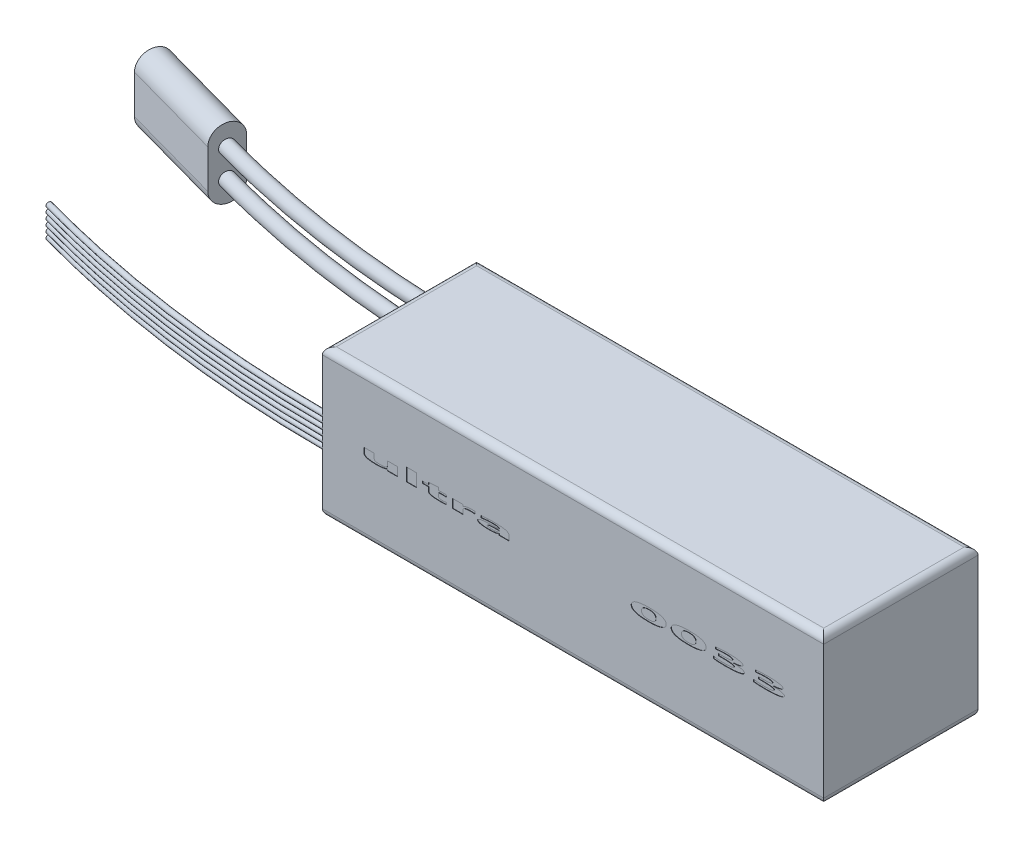
from build123d import *

# Parameters (mm, degrees)
SKETCH_1_W          = 143
SKETCH_1_H          = 42
EXTRUDE_1_DEPTH     = 22
SKETCH_2_R          = 2
SKETCH_2_R_2        = 0.75
SKETCH_32_W         = 2.902439024
SKETCH_32_H         = 3.670731708
CUT_EXTRUDE_1_DEPTH = 0.1
EXTRUDE_3_DEPTH     = 30
FILLET_1_R          = 2


with BuildPart() as part:
    # 草图1 → 凸台-拉伸1 (new, symmetric)
    with BuildSketch(Plane.XY):
        Rectangle(SKETCH_1_W, SKETCH_1_H)
    extrude(amount=EXTRUDE_1_DEPTH, both=True)

    # 扫描2: sweep along a path in 草图3
    with BuildLine(Plane(origin=(0, 0, 0), x_dir=(1, 0, 0), z_dir=(0, 1, 0))) as sweep_2_path:
        ThreePointArc((-71.5, 20), (-111.867104375, 22.728244052), (-151.5, 30.863354104))
    # 草图2 → 扫描2 (sweep)
    with BuildSketch(Plane.ZY.offset(71.5)):
        with Locations((-20, 4)):
            Circle(SKETCH_2_R)
        with Locations((21.25, 0.8)):
            Circle(SKETCH_2_R_2)
        with Locations((21.25, 2.4)):
            Circle(SKETCH_2_R_2)
        with Locations((21.25, 4)):
            Circle(SKETCH_2_R_2)
        with Locations((21.25, -0.8)):
            Circle(SKETCH_2_R_2)
        with Locations((21.25, -2.4)):
            Circle(SKETCH_2_R_2)
        with Locations((21.25, -4)):
            Circle(SKETCH_2_R_2)
        with Locations((-20, -4)):
            Circle(SKETCH_2_R)
    sweep(path=sweep_2_path.line)

    # 草图32 → 切除-拉伸1 (cut)
    # profile 1 of 9: a face of its own
    with BuildSketch(Plane.XY.offset(22)):
        with BuildLine():
            Line((-50.084332555, -0.379091749), (-52.986771579, -0.379091749))
            Line((-52.986771579, -0.379091749), (-52.986771579, 0.015725324))
            Line((-52.986771579, 0.015725324), (-53.032122189, 0.015725324))
            add(Edge.make_bspline(
                [(-53.032122189, 0.015725324), (-53.079807321, -0.00214651), (-53.177064788, -0.03859748), (-53.327216491, -0.088202246), (-53.484040644, -0.134401902), (-53.647137821, -0.176819159), (-53.816816999, -0.216165986), (-53.992663919, -0.252311657), (-54.175172874, -0.283816269), (-54.363809997, -0.313703103), (-54.559195911, -0.338308956), (-54.760968579, -0.361609314), (-54.969165309, -0.379746528), (-55.183930467, -0.395261927), (-55.404946084, -0.407057701), (-55.63260487, -0.41596219), (-55.866518719, -0.420279868), (-56.024594244, -0.421272246), (-56.104626, -0.421774676)],
                knots=[0, 0, 0, 0, 0.783356203, 1.597714767, 2.432050464, 3.29805557, 4.189850882, 5.111412776, 6.059381926, 7.038857091, 8.049295901, 9.08864698, 10.163367294, 11.263987033, 12.401079425, 13.568131017, 14.768773685, 16, 16, 16, 16], degree=3))
            add(Edge.make_bspline(
                [(-56.104626, -0.421774676), (-56.17643109, -0.421393385), (-56.317600267, -0.420643766), (-56.52592907, -0.418453944), (-56.727325476, -0.41257672), (-56.922112971, -0.406466657), (-57.10996881, -0.396984641), (-57.291125959, -0.38538358), (-57.465508282, -0.373279257), (-57.632896714, -0.357730094), (-57.793419838, -0.340382104), (-57.947094997, -0.321287509), (-58.093982454, -0.299630949), (-58.23422497, -0.277466299), (-58.367381575, -0.252028399), (-58.493897032, -0.224608336), (-58.613623479, -0.195553097), (-58.726596046, -0.16413136), (-58.832575685, -0.131045484), (-58.931534893, -0.095556321), (-59.023922189, -0.058537547), (-59.109089303, -0.018269971), (-59.188148989, 0.022847481), (-59.260241077, 0.066050678), (-59.325544247, 0.111470853), (-59.383416001, 0.159585211), (-59.435208141, 0.209004342), (-59.480505364, 0.260346462), (-59.517659763, 0.314659826), (-59.548842419, 0.370331278), (-59.573111739, 0.428248515), (-59.590452701, 0.488188485), (-59.600772295, 0.550460778), (-59.602001283, 0.592572942), (-59.602625238, 0.613953221)],
                knots=[0, 0, 0, 0, 1.76739026, 3.474698327, 5.127728865, 6.726399465, 8.27131683, 9.757059946, 11.194407816, 12.573556335, 13.894445802, 15.168327992, 16.384767607, 17.548785597, 18.662701598, 19.720904681, 20.734807802, 21.694617995, 22.606619483, 23.466789588, 24.281685953, 25.055190409, 25.78454863, 26.474263981, 27.122445841, 27.740359492, 28.324704387, 28.88319231, 29.422008092, 29.941242505, 30.451373214, 30.963962964, 31.474005631, 32, 32, 32, 32], degree=3))
            Line((-59.602625238, 0.613953221), (-59.602625238, 2.096518007))
            Line((-59.602625238, 2.096518007), (-56.700186213, 2.096518007))
            Line((-56.700186213, 2.096518007), (-56.700186213, 0.683312977))
            add(Edge.make_bspline(
                [(-56.700186213, 0.683312977), (-56.699014721, 0.660908506), (-56.696700508, 0.616649795), (-56.67460876, 0.552868669), (-56.639017287, 0.493806726), (-56.589279774, 0.439502289), (-56.525926441, 0.389938219), (-56.449202973, 0.344647672), (-56.358318064, 0.304462412), (-56.25416494, 0.267968487), (-56.136116698, 0.236411551), (-56.004796248, 0.208509387), (-55.859381699, 0.185522075), (-55.700301662, 0.166506687), (-55.527281701, 0.151075375), (-55.340431568, 0.1409434), (-55.139867429, 0.133952646), (-55.001545722, 0.133392421), (-54.930178591, 0.133103373)],
                knots=[0, 0, 0, 0, 0.53938468, 1.065522613, 1.609507161, 2.194740216, 2.832610174, 3.545037997, 4.340126746, 5.227903774, 6.207009475, 7.288086108, 8.467793818, 9.759933909, 11.155477441, 12.660710849, 14.277092672, 16, 16, 16, 16], degree=3))
            add(Edge.make_bspline(
                [(-54.930178591, 0.133103373), (-54.858369569, 0.133719622), (-54.718277665, 0.134921859), (-54.513659041, 0.141232358), (-54.319956517, 0.153264766), (-54.137617549, 0.169956792), (-53.96621711, 0.190120352), (-53.806268315, 0.216131811), (-53.657143301, 0.246665528), (-53.519940025, 0.281505073), (-53.396368451, 0.320178317), (-53.288299776, 0.362639539), (-53.196346584, 0.408185469), (-53.120567029, 0.457037315), (-53.061526521, 0.510277988), (-53.019001701, 0.567103628), (-52.991090316, 0.628019193), (-52.988201051, 0.670811389), (-52.986771579, 0.691982946)],
                knots=[0, 0, 0, 0, 1.611592577, 3.144048836, 4.593662917, 5.966345884, 7.252877499, 8.465959956, 9.601945686, 10.667996432, 11.641529703, 12.505906458, 13.271204144, 13.940929636, 14.523540873, 15.04441488, 15.527221624, 16, 16, 16, 16], degree=3))
            Line((-52.986771579, 0.691982946), (-52.986771579, 2.096518007))
            Line((-52.986771579, 2.096518007), (-50.084332555, 2.096518007))
            Line((-50.084332555, 2.096518007), (-50.084332555, -0.379091749))
        make_face()
    # profile 2 of 9: a face of its own
    with BuildSketch(Plane.XY.offset(22)):
        with Locations((-46.029454506, 1.456274105)):
            Rectangle(SKETCH_32_W, SKETCH_32_H)
    # profile 3 of 9: a face of its own
    with BuildSketch(Plane.XY.offset(22)):
        with BuildLine():
            add(Edge.make_bspline(
                [(-36.084332555, -0.330406535), (-36.112545055, -0.334354007), (-36.170883869, -0.342516729), (-36.26128665, -0.351779519), (-36.356775962, -0.362390684), (-36.457551497, -0.370646762), (-36.563583833, -0.378801757), (-36.674999377, -0.385799622), (-36.791438134, -0.39358101), (-36.913297791, -0.399277605), (-37.040234787, -0.404662009), (-37.172734776, -0.409253188), (-37.310335398, -0.413502613), (-37.453522577, -0.415707709), (-37.60179275, -0.418599011), (-37.755407311, -0.420784347), (-37.914141313, -0.421032085), (-38.021737485, -0.421524433), (-38.07642478, -0.421774676)],
                knots=[0, 0, 0, 0, 0.685165778, 1.416810188, 2.18567112, 2.996102101, 3.84874272, 4.743678953, 5.681305401, 6.65570541, 7.677937525, 8.737366787, 9.84472529, 10.989249974, 12.181892401, 13.411878814, 14.684550341, 16, 16, 16, 16], degree=3))
            add(Edge.make_bspline(
                [(-38.07642478, -0.421774676), (-38.141561847, -0.421712167), (-38.269618788, -0.421589277), (-38.458583609, -0.418673497), (-38.641323711, -0.414694375), (-38.817862291, -0.409637702), (-38.988364225, -0.402070799), (-39.152660133, -0.393486534), (-39.310759575, -0.383668794), (-39.462625257, -0.371735074), (-39.608169828, -0.357368136), (-39.747671796, -0.343203575), (-39.880850194, -0.326404339), (-40.007783997, -0.307767489), (-40.128741324, -0.287762291), (-40.243279212, -0.266542495), (-40.351845222, -0.243865467), (-40.454255107, -0.219545887), (-40.550130646, -0.192555253), (-40.640174164, -0.165384115), (-40.723980283, -0.13637085), (-40.801478247, -0.104794243), (-40.872854176, -0.072414555), (-40.938135281, -0.038182811), (-40.997274957, -0.002489651), (-41.050258472, 0.034782139), (-41.096802444, 0.073912648), (-41.137566308, 0.114216437), (-41.172025213, 0.156692799), (-41.200276418, 0.2006453), (-41.221762217, 0.246481855), (-41.237319152, 0.293694863), (-41.246921858, 0.342575568), (-41.24828255, 0.375820235), (-41.248966701, 0.392535538)],
                knots=[0, 0, 0, 0, 1.80325348, 3.545126297, 5.231839685, 6.863502107, 8.434336881, 9.956580867, 11.418095201, 12.819532181, 14.173530992, 15.466909818, 16.701264742, 17.889321508, 19.018467601, 20.095190887, 21.113927491, 22.088678474, 23.008469842, 23.870900526, 24.692278348, 25.462564036, 26.186852413, 26.861315418, 27.501995417, 28.097957442, 28.652708723, 29.183631628, 29.682480867, 30.163943228, 30.626466908, 31.079934809, 31.537394435, 32, 32, 32, 32], degree=3))
            Line((-41.248966701, 0.392535538), (-41.248966701, 1.541639959))
            Line((-41.248966701, 1.541639959), (-42.870917921, 1.541639959))
            Line((-42.870917921, 1.541639959), (-42.870917921, 2.096518007))
            Line((-42.870917921, 2.096518007), (-41.248966701, 2.096518007))
            Line((-41.248966701, 2.096518007), (-41.248966701, 2.654063739))
            Line((-41.248966701, 2.654063739), (-38.346527677, 2.86481069))
            Line((-38.346527677, 2.86481069), (-38.346527677, 2.096518007))
            Line((-38.346527677, 2.096518007), (-36.084332555, 2.096518007))
            Line((-36.084332555, 2.096518007), (-36.084332555, 1.541639959))
            Line((-36.084332555, 1.541639959), (-38.346527677, 1.541639959))
            Line((-38.346527677, 1.541639959), (-38.346527677, 0.520584318))
            add(Edge.make_bspline(
                [(-38.346527677, 0.520584318), (-38.345696005, 0.504905797), (-38.34404187, 0.473722371), (-38.328562651, 0.428735813), (-38.303025238, 0.387185436), (-38.267689273, 0.349042198), (-38.222651407, 0.314192183), (-38.168205882, 0.282179035), (-38.103694728, 0.254067474), (-38.03001121, 0.227916456), (-37.946339898, 0.205537201), (-37.852937293, 0.186619325), (-37.749703106, 0.169956036), (-37.636702683, 0.156086733), (-37.51390564, 0.145528882), (-37.381335461, 0.1385376), (-37.239031863, 0.133611309), (-37.140739622, 0.133276196), (-37.090049018, 0.133103373)],
                knots=[0, 0, 0, 0, 0.532584565, 1.059271481, 1.599389592, 2.183503827, 2.819613793, 3.532416301, 4.328769186, 5.212325726, 6.19303158, 7.275414469, 8.456548158, 9.753331147, 11.15157668, 12.652865376, 14.273838587, 16, 16, 16, 16], degree=3))
            add(Edge.make_bspline(
                [(-37.090049018, 0.133103373), (-37.008435982, 0.134145705), (-36.843501983, 0.136252182), (-36.594107398, 0.153108396), (-36.340184719, 0.179270683), (-36.170270893, 0.205302804), (-36.084332555, 0.218469227)],
                knots=[0, 0, 0, 0, 0.969215658, 1.958714213, 2.967566605, 4, 4, 4, 4], degree=3))
            Line((-36.084332555, 0.218469227), (-36.084332555, -0.330406535))
        make_face()
    # profile 4 of 9: a face of its own
    with BuildSketch(Plane.XY.offset(22)):
        with BuildLine():
            add(Edge.make_bspline(
                [(-27.974576457, 1.413591178), (-28.020338523, 1.420501335), (-28.113925991, 1.434633216), (-28.258067155, 1.451666768), (-28.409262048, 1.466415874), (-28.56759148, 1.478255144), (-28.733016881, 1.487561311), (-28.905331947, 1.494148672), (-29.084757227, 1.498229232), (-29.206821436, 1.498711231), (-29.269069598, 1.498957032)],
                knots=[0, 0, 0, 0, 0.855296309, 1.749156539, 2.682085642, 3.662721282, 4.683272414, 5.744083064, 6.84956709, 8, 8, 8, 8], degree=3))
            add(Edge.make_bspline(
                [(-29.269069598, 1.498957032), (-29.349775338, 1.498523677), (-29.507012498, 1.497679382), (-29.736529255, 1.488864161), (-29.953407106, 1.474515131), (-30.157354988, 1.453822168), (-30.348540561, 1.428200938), (-30.526824417, 1.396346957), (-30.692515786, 1.358607665), (-30.844385214, 1.315008521), (-30.981091439, 1.267115012), (-31.100231724, 1.214186327), (-31.201365924, 1.156982385), (-31.284798143, 1.095707899), (-31.350609464, 1.029447541), (-31.397010079, 0.957448693), (-31.42652061, 0.880688249), (-31.430099802, 0.827397785), (-31.43189353, 0.800691026)],
                knots=[0, 0, 0, 0, 1.597682701, 3.112728912, 4.546347598, 5.899965921, 7.170318736, 8.364240299, 9.484161559, 10.533028123, 11.490742214, 12.349614957, 13.11057891, 13.786582693, 14.393498636, 14.947753016, 15.472661606, 16, 16, 16, 16], degree=3))
            Line((-31.43189353, 0.800691026), (-31.43189353, -0.379091749))
            Line((-31.43189353, -0.379091749), (-34.334332555, -0.379091749))
            Line((-34.334332555, -0.379091749), (-34.334332555, 2.096518007))
            Line((-34.334332555, 2.096518007), (-31.43189353, 2.096518007))
            Line((-31.43189353, 2.096518007), (-31.43189353, 1.613667398))
            Line((-31.43189353, 1.613667398), (-31.395879811, 1.613667398))
            add(Edge.make_bspline(
                [(-31.395879811, 1.613667398), (-31.364347466, 1.635185413), (-31.299736272, 1.679276793), (-31.195216637, 1.739453755), (-31.080976078, 1.794279014), (-30.957884106, 1.845716881), (-30.825730764, 1.893156167), (-30.683889187, 1.935268115), (-30.533253347, 1.974985028), (-30.372916106, 2.009222516), (-30.203429916, 2.039880515), (-30.024807028, 2.066368761), (-29.836886513, 2.088983252), (-29.639878118, 2.107751714), (-29.433456614, 2.121182325), (-29.218041394, 2.132256715), (-28.993218954, 2.138039024), (-28.840242356, 2.138808453), (-28.762209841, 2.139200934)],
                knots=[0, 0, 0, 0, 0.67276467, 1.378525063, 2.123390148, 2.905023924, 3.729305773, 4.597104218, 5.51241563, 6.474729393, 7.486274052, 8.548122794, 9.657312872, 10.82243049, 12.036106449, 13.303403246, 14.624480931, 16, 16, 16, 16], degree=3))
            add(Edge.make_bspline(
                [(-28.762209841, 2.139200934), (-28.720415722, 2.139035504), (-28.639493221, 2.138715195), (-28.521891032, 2.137319989), (-28.412058879, 2.135522708), (-28.309776015, 2.132343948), (-28.215110452, 2.127229311), (-28.12791072, 2.12304412), (-28.048502662, 2.117195089), (-27.998350929, 2.111764077), (-27.974576457, 2.109189501)],
                knots=[0, 0, 0, 0, 1.272022148, 2.462911431, 3.579482566, 4.615230064, 5.57716582, 6.464773631, 7.27222462, 8, 8, 8, 8], degree=3))
            Line((-27.974576457, 2.109189501), (-27.974576457, 1.413591178))
        make_face()
    # profile 5 of 9: a face of its own
    with BuildSketch(Plane.XY.offset(22)):
        with BuildLine():
            add(Edge.make_bspline(
                [(-26.224576457, 1.928453983), (-26.165683309, 1.936156444), (-26.043328501, 1.952158869), (-25.852590781, 1.974155253), (-25.647554285, 1.99448444), (-25.428420561, 2.014909954), (-25.194899251, 2.032278932), (-24.947284293, 2.049984684), (-24.68536119, 2.065614816), (-24.413258561, 2.080792862), (-24.13915149, 2.094613203), (-23.871267476, 2.106611204), (-23.613612778, 2.116737996), (-23.366167374, 2.124515213), (-23.128975476, 2.131453155), (-22.902214526, 2.136070066), (-22.685902715, 2.138929421), (-22.545175616, 2.139111873), (-22.476481945, 2.139200934)],
                knots=[0, 0, 0, 0, 0.759015838, 1.576910728, 2.453509396, 3.392050912, 4.389328333, 5.445895971, 6.564458827, 7.742414751, 8.928581073, 10.071776556, 11.169200666, 12.223734441, 13.235502099, 14.201620747, 15.122150072, 16, 16, 16, 16], degree=3))
            add(Edge.make_bspline(
                [(-22.476481945, 2.139200934), (-22.390449246, 2.13881876), (-22.22127019, 2.138067233), (-21.97159624, 2.135889153), (-21.730184377, 2.12997237), (-21.496937941, 2.124009019), (-21.271772616, 2.114035275), (-21.054733294, 2.104020895), (-20.845996535, 2.090405674), (-20.645447807, 2.075210741), (-20.453177648, 2.057669057), (-20.268768112, 2.039474461), (-20.092933157, 2.017987294), (-19.925063958, 1.994653546), (-19.765392258, 1.969466421), (-19.613918265, 1.942322216), (-19.470854095, 1.912558466), (-19.335589526, 1.882618574), (-19.208703841, 1.848988268), (-19.08986977, 1.813816309), (-18.97924313, 1.776619305), (-18.876674155, 1.737479123), (-18.782793338, 1.695250597), (-18.696388634, 1.652143748), (-18.618206238, 1.607026992), (-18.548447303, 1.559518889), (-18.486703618, 1.510197591), (-18.433072113, 1.458694839), (-18.386928795, 1.405353976), (-18.350437764, 1.348944763), (-18.320878169, 1.291304841), (-18.301143224, 1.230936571), (-18.287631779, 1.168986285), (-18.286245956, 1.126664535), (-18.285552067, 1.1054738)],
                knots=[0, 0, 0, 0, 1.811908197, 3.563028022, 5.25827907, 6.897602554, 8.476753922, 10.004880979, 11.473295104, 12.881978147, 14.240503457, 15.539332391, 16.784393166, 17.970912619, 19.108559056, 20.188539906, 21.211418856, 22.185934266, 23.105775931, 23.97530661, 24.795529755, 25.563270918, 26.286313071, 26.962612509, 27.596189173, 28.185751791, 28.73852987, 29.258386218, 29.749960357, 30.220039771, 30.67020597, 31.109928114, 31.554336065, 32, 32, 32, 32], degree=3))
            Line((-18.285552067, 1.1054738), (-18.285552067, -0.379091749))
            Line((-18.285552067, -0.379091749), (-21.059942311, -0.379091749))
            Line((-21.059942311, -0.379091749), (-21.059942311, -0.025623761))
            Line((-21.059942311, -0.025623761), (-21.09595603, -0.025623761))
            add(Edge.make_bspline(
                [(-21.09595603, -0.025623761), (-21.139626216, -0.041983449), (-21.228596403, -0.075313386), (-21.367385622, -0.119666687), (-21.513211286, -0.161747301), (-21.666718696, -0.200328469), (-21.827817947, -0.23550364), (-21.996121483, -0.268148635), (-22.171802239, -0.297506245), (-22.354871262, -0.323261631), (-22.545380283, -0.34678221), (-22.743332052, -0.366390639), (-22.948508759, -0.383996872), (-23.161081364, -0.397879082), (-23.381212213, -0.408297105), (-23.608862463, -0.416455797), (-23.843871398, -0.421160661), (-24.003061442, -0.42156812), (-24.083760909, -0.421774676)],
                knots=[0, 0, 0, 0, 0.738801569, 1.505175939, 2.307861001, 3.143370365, 4.012548928, 4.920270715, 5.859531282, 6.834390494, 7.849306261, 8.900776063, 9.986017387, 11.112088238, 12.275838592, 13.477713152, 14.721357204, 16, 16, 16, 16], degree=3))
            add(Edge.make_bspline(
                [(-24.083760909, -0.421774676), (-24.198920355, -0.421039094), (-24.423269894, -0.41960606), (-24.751043399, -0.41125656), (-25.061235323, -0.395916225), (-25.353888607, -0.374770329), (-25.629079805, -0.347925285), (-25.886337068, -0.313720233), (-26.126299466, -0.274952653), (-26.314436997, -0.23640579), (-26.454704021, -0.201832963), (-26.551601393, -0.176163843), (-26.641549526, -0.148609509), (-26.724973621, -0.121040409), (-26.801479225, -0.091513238), (-26.871246765, -0.060836584), (-26.935237573, -0.029984605), (-26.99144622, 0.003763158), (-27.042411812, 0.036675909), (-27.085609876, 0.072192629), (-27.122658337, 0.108165422), (-27.153241468, 0.145061222), (-27.176979951, 0.1833917), (-27.193862689, 0.223172381), (-27.20433428, 0.264172947), (-27.205636081, 0.291993898), (-27.206283774, 0.305835843)],
                knots=[0, 0, 0, 0, 2.474402142, 4.820542302, 7.044383916, 9.146881687, 11.124567834, 12.984365061, 14.722173704, 16.346574191, 17.108874752, 17.826099132, 18.500025257, 19.129904934, 19.713590942, 20.261154454, 20.767430643, 21.23847857, 21.669036882, 22.069646595, 22.437818011, 22.777260327, 23.096758429, 23.402834772, 23.702888366, 24, 24, 24, 24], degree=3))
            add(Edge.make_bspline(
                [(-27.206283774, 0.305835843), (-27.20563751, 0.320121348), (-27.204339282, 0.34881833), (-27.193865343, 0.39112703), (-27.177053593, 0.432282394), (-27.153030814, 0.471923286), (-27.123188773, 0.511024874), (-27.084706863, 0.547200898), (-27.041863721, 0.58435489), (-26.990898918, 0.618888579), (-26.933837201, 0.652640693), (-26.870145219, 0.685367679), (-26.799818697, 0.716814643), (-26.722531471, 0.746297391), (-26.638758611, 0.775850791), (-26.548569972, 0.804517274), (-26.45117796, 0.830941028), (-26.34760405, 0.856917612), (-26.23710435, 0.881712283), (-26.119809043, 0.904692197), (-25.996030394, 0.927487354), (-25.865513357, 0.948833364), (-25.728321317, 0.968788221), (-25.584190838, 0.987185926), (-25.433513423, 1.005454351), (-25.276050109, 1.021788023), (-25.112025003, 1.038026954), (-24.941271561, 1.052588983), (-24.763860553, 1.065906561), (-24.57978145, 1.077913561), (-24.389013788, 1.088402745), (-24.191600469, 1.098322275), (-23.987553971, 1.108108934), (-23.849234534, 1.11255328), (-23.778978134, 1.11481069)],
                knots=[0, 0, 0, 0, 0.373265338, 0.749822201, 1.133141969, 1.532022019, 1.958867263, 2.4152634, 2.910354772, 3.441010414, 4.022378518, 4.643910476, 5.312811592, 6.036273818, 6.806806344, 7.636170386, 8.510772754, 9.445759431, 10.428986466, 11.472386951, 12.571814274, 13.720817672, 14.931250702, 16.197702588, 17.521136302, 18.901048754, 20.338220023, 21.832232123, 23.38326898, 24.991494956, 26.657057481, 28.38037376, 30.161488269, 32, 32, 32, 32], degree=3))
            Line((-23.778978134, 1.11481069), (-21.029930878, 1.204844989))
            add(Edge.make_bspline(
                [(-21.029930878, 1.204844989), (-21.031342149, 1.222207789), (-21.03416644, 1.2569549), (-21.057784194, 1.306209435), (-21.094181757, 1.351476462), (-21.145046199, 1.393052075), (-21.21006362, 1.430766996), (-21.289090245, 1.464781531), (-21.381888685, 1.496089349), (-21.488736461, 1.523588377), (-21.609853199, 1.548108339), (-21.744972082, 1.56902795), (-21.894225978, 1.587021418), (-22.057741405, 1.601184665), (-22.235585465, 1.613567919), (-22.427753239, 1.62077915), (-22.633838383, 1.626719237), (-22.775924212, 1.626908227), (-22.849290634, 1.627005812)],
                knots=[0, 0, 0, 0, 0.422546161, 0.845615815, 1.309701745, 1.834152155, 2.440668646, 3.1411821, 3.933148203, 4.831789274, 5.835398435, 6.951805147, 8.172090754, 9.508398422, 10.962157389, 12.528063162, 14.207255543, 16, 16, 16, 16], degree=3))
            add(Edge.make_bspline(
                [(-22.849290634, 1.627005812), (-22.997577517, 1.626248205), (-23.291976987, 1.6247441), (-23.730221759, 1.612357957), (-24.161802871, 1.592530273), (-24.586936231, 1.564498657), (-25.005640041, 1.528616115), (-25.417871866, 1.484512007), (-25.823757423, 1.432995401), (-26.091501727, 1.39152162), (-26.224576457, 1.370908251)],
                knots=[0, 0, 0, 0, 1.050252231, 2.085104865, 3.104918582, 4.110070253, 5.102522206, 6.081113437, 7.04627173, 8, 8, 8, 8], degree=3))
            Line((-26.224576457, 1.370908251), (-26.224576457, 1.928453983))
        make_face()
        with BuildLine():
            add(Edge.make_bspline(
                [(-22.904645055, 0.730664349), (-22.968005464, 0.728311979), (-23.090750673, 0.723754842), (-23.268670835, 0.715629194), (-23.434253348, 0.703845869), (-23.587500774, 0.691622181), (-23.728479549, 0.676940282), (-23.857284913, 0.660537625), (-23.973762321, 0.641747657), (-24.078346139, 0.622424918), (-24.170323762, 0.599474203), (-24.250575501, 0.576162708), (-24.318468477, 0.550218264), (-24.37440385, 0.522832543), (-24.417971922, 0.492730685), (-24.450177489, 0.461151868), (-24.470920631, 0.426232794), (-24.47339037, 0.401215461), (-24.474576457, 0.389200934)],
                knots=[0, 0, 0, 0, 1.825814148, 3.537065858, 5.128388005, 6.605771099, 7.963830762, 9.209661535, 10.344190327, 11.361138279, 12.270976447, 13.072992316, 13.766081826, 14.361568186, 14.862408936, 15.28340838, 15.65585823, 16, 16, 16, 16], degree=3))
            add(Edge.make_bspline(
                [(-24.474576457, 0.389200934), (-24.473347641, 0.378068266), (-24.470781886, 0.354823363), (-24.450545417, 0.322682572), (-24.419888015, 0.292716048), (-24.376983484, 0.265451022), (-24.323203851, 0.238720107), (-24.257357737, 0.214462876), (-24.17966861, 0.192193413), (-24.090855305, 0.171144847), (-23.991857571, 0.151953511), (-23.883932564, 0.135511016), (-23.767827064, 0.12152899), (-23.643469257, 0.11055637), (-23.510991763, 0.100800999), (-23.369964834, 0.09545453), (-23.220792897, 0.091063043), (-23.118508149, 0.090638316), (-23.066039872, 0.090420446)],
                knots=[0, 0, 0, 0, 0.355326299, 0.74191785, 1.18572484, 1.725754277, 2.363681972, 3.110799891, 3.972946839, 4.955541878, 6.038188062, 7.207289554, 8.457306389, 9.789433991, 11.212259461, 12.718532247, 14.316728924, 16, 16, 16, 16], degree=3))
            add(Edge.make_bspline(
                [(-23.066039872, 0.090420446), (-22.993786504, 0.091041157), (-22.852361727, 0.092256102), (-22.64507527, 0.098562189), (-22.447388428, 0.110714847), (-22.259655844, 0.127102838), (-22.081714958, 0.148441848), (-21.913722533, 0.174204066), (-21.755315905, 0.204891759), (-21.607861796, 0.239505032), (-21.474322457, 0.27836112), (-21.357215436, 0.319298073), (-21.257729693, 0.362113379), (-21.176013218, 0.407666737), (-21.112156899, 0.456199976), (-21.065638745, 0.506862016), (-21.034903995, 0.561111274), (-21.031556377, 0.599823983), (-21.029930878, 0.618621666)],
                knots=[0, 0, 0, 0, 1.576341543, 3.085444435, 4.523670979, 5.89671077, 7.196089629, 8.432817789, 9.60369801, 10.715355087, 11.735971138, 12.636397935, 13.42036075, 14.095910472, 14.673131785, 15.160879838, 15.592549461, 16, 16, 16, 16], degree=3))
            Line((-21.029930878, 0.618621666), (-21.029930878, 0.790020294))
            Line((-21.029930878, 0.790020294), (-22.904645055, 0.730664349))
        make_face(mode=Mode.SUBTRACT)
    # profile 6 of 9: a face of its own
    with BuildSketch(Plane.XY.offset(22)):
        with BuildLine():
            add(Edge.make_bspline(
                [(16.586399152, 1.31488691), (16.587460604, 1.35184137), (16.589560783, 1.424959113), (16.605226696, 1.532931622), (16.631354896, 1.637730569), (16.668160322, 1.739119924), (16.715127078, 1.837293454), (16.772956405, 1.931513792), (16.840881133, 2.022712724), (16.918921889, 2.110908321), (17.008300253, 2.194782706), (17.107328198, 2.275868166), (17.217254327, 2.352820687), (17.336610786, 2.427904718), (17.467197822, 2.498375085), (17.608154536, 2.56533737), (17.758912338, 2.630423637), (17.920517464, 2.690637787), (18.091669339, 2.747688084), (18.271927851, 2.801959173), (18.461797612, 2.851634921), (18.660690473, 2.898589561), (18.869345998, 2.939888513), (19.086651092, 2.979673438), (19.313507774, 3.014827908), (19.549708446, 3.045911307), (19.795139009, 3.074043277), (20.049737344, 3.098001081), (20.313715667, 3.117485854), (20.586660617, 3.135477283), (20.869301529, 3.147502948), (21.160974894, 3.157101897), (21.462015595, 3.162283083), (21.66566575, 3.163150746), (21.769040159, 3.163591178)],
                knots=[0, 0, 0, 0, 0.596595334, 1.180417868, 1.757658752, 2.337927806, 2.919162099, 3.512041439, 4.120157207, 4.75335437, 5.411029381, 6.097278814, 6.818387203, 7.576375327, 8.373120841, 9.212868876, 10.095728912, 11.023845381, 11.996702661, 13.008619979, 14.06306903, 15.16543593, 16.308052725, 17.497332763, 18.732598434, 20.014532479, 21.344148006, 22.721520551, 24.143567989, 25.618334816, 27.13834343, 28.711470717, 30.330716862, 32, 32, 32, 32], degree=3))
            add(Edge.make_bspline(
                [(21.769040159, 3.163591178), (21.8675231, 3.163090369), (22.061387164, 3.162104525), (22.347758011, 3.157795507), (22.624763888, 3.148871521), (22.892486458, 3.137321424), (23.150553948, 3.120802403), (23.399209968, 3.102793844), (23.638407903, 3.079800321), (23.868334029, 3.053997523), (24.089140498, 3.024709651), (24.300403849, 2.992157235), (24.502389632, 2.956271596), (24.694752835, 2.916402685), (24.877681499, 2.872857303), (25.051578113, 2.827127839), (25.21613221, 2.777508436), (25.370895689, 2.723057297), (25.516803768, 2.666883969), (25.652887533, 2.606046315), (25.779874125, 2.542169162), (25.897497224, 2.47481513), (26.00576339, 2.40434865), (26.104541647, 2.329969677), (26.193677714, 2.251956852), (26.274650792, 2.171413357), (26.344642141, 2.085994491), (26.406542217, 1.998157538), (26.458324421, 1.906061108), (26.500000007, 1.810442476), (26.53420872, 1.71188864), (26.557054054, 1.609393416), (26.571625258, 1.503601879), (26.573337784, 1.431868971), (26.574204031, 1.395584318)],
                knots=[0, 0, 0, 0, 1.699289301, 3.34505777, 4.941521012, 6.481217446, 7.968515923, 9.403287198, 10.782675334, 12.114447828, 13.395259361, 14.625642079, 15.802420234, 16.934599154, 18.014771291, 19.046595988, 20.036747331, 20.97932723, 21.876842269, 22.733664756, 23.550208438, 24.328569299, 25.071166708, 25.777721048, 26.460069466, 27.113740773, 27.745818585, 28.362985858, 28.965801526, 29.565190409, 30.160774704, 30.762808826, 31.374191657, 32, 32, 32, 32], degree=3))
            add(Edge.make_bspline(
                [(26.574204031, 1.395584318), (26.573154942, 1.359737505), (26.571079624, 1.288824918), (26.55524711, 1.184254481), (26.529802502, 1.082854502), (26.494328234, 0.984194425), (26.448178278, 0.888825869), (26.39154503, 0.796638195), (26.324546799, 0.708184462), (26.247988637, 0.622157489), (26.161028479, 0.5396574), (26.063933679, 0.459969563), (25.956050822, 0.384276092), (25.838622779, 0.310819331), (25.710937759, 0.240892783), (25.57301096, 0.174259698), (25.425075642, 0.110320118), (25.266980783, 0.04994536), (25.099574859, -0.007526388), (24.922575038, -0.060610429), (24.736587375, -0.110376024), (24.541950244, -0.157466014), (24.337736593, -0.198777928), (24.124928786, -0.238683413), (23.902602778, -0.272738413), (23.671602225, -0.304162692), (23.431498269, -0.332288591), (23.182192757, -0.35590896), (22.92387236, -0.376796129), (22.656609043, -0.393349246), (22.38023133, -0.405763398), (22.094775624, -0.415275769), (21.800182556, -0.420467312), (21.600755669, -0.421334718), (21.499604183, -0.421774676)],
                knots=[0, 0, 0, 0, 0.591203631, 1.169525965, 1.740592652, 2.313693139, 2.896013741, 3.485394424, 4.095674748, 4.724314193, 5.383208243, 6.071164273, 6.794675725, 7.555866325, 8.355240226, 9.195068535, 10.082129902, 11.013210321, 11.98629987, 13.001521767, 14.061093913, 15.162360132, 16.304575942, 17.497972414, 18.734066468, 20.014691877, 21.343964054, 22.721966588, 24.145853775, 25.619395626, 27.139358413, 28.709908231, 30.331229672, 32, 32, 32, 32], degree=3))
            add(Edge.make_bspline(
                [(21.499604183, -0.421774676), (21.3988981, -0.421274891), (21.200587996, -0.420290718), (20.907772438, -0.415966353), (20.624536887, -0.407122157), (20.351068519, -0.395255995), (20.087161994, -0.379908551), (19.832801361, -0.361372621), (19.587999221, -0.339433769), (19.352971004, -0.314160337), (19.127515977, -0.285456817), (18.911481721, -0.253943897), (18.705296153, -0.2173979), (18.508263909, -0.179397447), (18.321188107, -0.136342755), (18.143242459, -0.091471569), (17.975350491, -0.042092314), (17.81693261, 0.010544328), (17.668049959, 0.066502715), (17.52859344, 0.125577421), (17.398851676, 0.188393737), (17.27862975, 0.254133719), (17.167915922, 0.32381987), (17.066788478, 0.396644019), (16.975208403, 0.473349828), (16.89318171, 0.552801386), (16.821145867, 0.636466483), (16.758111887, 0.722928578), (16.705279601, 0.813567188), (16.661470921, 0.907168496), (16.628106359, 1.004512998), (16.604168006, 1.105000376), (16.588821868, 1.208818814), (16.58721282, 1.279263995), (16.586399152, 1.31488691)],
                knots=[0, 0, 0, 0, 1.712615856, 3.372477765, 4.979952818, 6.531461549, 8.027298714, 9.475333962, 10.868384713, 12.206861795, 13.494978618, 14.733237972, 15.919124578, 17.055730792, 18.145263708, 19.183222953, 20.176141973, 21.120592746, 22.021477112, 22.880264193, 23.695246005, 24.47187501, 25.209232672, 25.91856253, 26.589454134, 27.239099889, 27.858287275, 28.464776038, 29.056111224, 29.639648615, 30.219500471, 30.802682611, 31.394537215, 32, 32, 32, 32], degree=3))
        make_face()
        with BuildLine():
            add(Edge.make_bspline(
                [(19.531521104, 1.33289377), (19.532990161, 1.284332227), (19.535853064, 1.189695362), (19.560083196, 1.052533697), (19.601150148, 0.924943055), (19.658185174, 0.806533008), (19.731446943, 0.697431324), (19.821687162, 0.59869799), (19.927057181, 0.508518434), (20.049947268, 0.429550243), (20.187810863, 0.358578868), (20.342227483, 0.298319202), (20.512324944, 0.24744982), (20.698257461, 0.204620769), (20.900650294, 0.17267058), (21.119021284, 0.149667772), (21.353362744, 0.135565957), (21.514922974, 0.133941697), (21.598308451, 0.133103373)],
                knots=[0, 0, 0, 0, 0.867014458, 1.689640118, 2.478304703, 3.254462885, 4.029848609, 4.817072196, 5.636749971, 6.500274286, 7.420272033, 8.402520048, 9.456513617, 10.589361813, 11.808243006, 13.114215913, 14.510571044, 16, 16, 16, 16], degree=3))
            add(Edge.make_bspline(
                [(21.598308451, 0.133103373), (21.680365391, 0.133867383), (21.839284234, 0.135347034), (22.069600819, 0.150436805), (22.284094508, 0.173646633), (22.482715353, 0.207728097), (22.665913452, 0.250362167), (22.833211323, 0.30361939), (22.984726875, 0.366090441), (23.120625175, 0.437949962), (23.240490795, 0.520432668), (23.344709699, 0.612734316), (23.433059644, 0.714902487), (23.505331337, 0.826813034), (23.561169207, 0.948811177), (23.600039132, 1.080659804), (23.624866375, 1.221698955), (23.627652937, 1.319003141), (23.629082079, 1.368907489)],
                knots=[0, 0, 0, 0, 1.468813375, 2.84463594, 4.130163212, 5.329466322, 6.4501975, 7.494849724, 8.468984462, 9.380595084, 10.241678765, 11.067611189, 11.866205062, 12.65220455, 13.444676169, 14.259293387, 15.107244698, 16, 16, 16, 16], degree=3))
            add(Edge.make_bspline(
                [(23.629082079, 1.368907489), (23.62750324, 1.41900975), (23.62442683, 1.516635334), (23.601741918, 1.658322825), (23.563027493, 1.790165289), (23.50849849, 1.912196053), (23.438561837, 2.024863829), (23.352355458, 2.127192799), (23.251286788, 2.220292052), (23.133978952, 2.30225772), (23.001697644, 2.374904662), (22.854431962, 2.438478727), (22.691250734, 2.490253297), (22.513372808, 2.53454572), (22.319864139, 2.567958799), (22.110975916, 2.591452186), (21.88685996, 2.606445557), (21.732162308, 2.607941258), (21.652329031, 2.608713129)],
                knots=[0, 0, 0, 0, 0.911870718, 1.776804283, 2.604018868, 3.406531292, 4.202722726, 5.010027101, 5.83490206, 6.697256503, 7.608417478, 8.578222585, 9.612310111, 10.721455883, 11.913098478, 13.18414222, 14.546848293, 16, 16, 16, 16], degree=3))
            add(Edge.make_bspline(
                [(21.652329031, 2.608713129), (21.608756422, 2.608381758), (21.523154857, 2.607730756), (21.39681989, 2.604834665), (21.274790014, 2.597677836), (21.15666572, 2.589447243), (21.042651636, 2.577737411), (20.932648835, 2.565048191), (20.827131867, 2.547919648), (20.725731752, 2.529282948), (20.628099725, 2.50905743), (20.535058134, 2.484776592), (20.44579153, 2.45878256), (20.360667854, 2.430420565), (20.279863523, 2.398780779), (20.202907024, 2.365616856), (20.130234134, 2.329737099), (20.061910528, 2.290920273), (19.997969202, 2.249470234), (19.937587826, 2.206185445), (19.881498594, 2.160025174), (19.829279446, 2.111529988), (19.782041215, 2.05986476), (19.738320466, 2.006405856), (19.698903584, 1.950214743), (19.663497705, 1.891373108), (19.632109421, 1.830170403), (19.605379073, 1.766328507), (19.582657645, 1.700158195), (19.564090927, 1.63150978), (19.549381513, 1.560471459), (19.538594245, 1.487011018), (19.532673738, 1.410800641), (19.531909354, 1.359135689), (19.531521104, 1.33289377)],
                knots=[0, 0, 0, 0, 1.499241751, 2.945369678, 4.347187331, 5.704670573, 7.01906198, 8.290350517, 9.513894667, 10.696072694, 11.837692093, 12.943359652, 14.003483661, 15.036297512, 16.029168773, 16.988322713, 17.918744399, 18.816231915, 19.690338871, 20.539492855, 21.370962896, 22.188096171, 22.989213824, 23.777633505, 24.562781413, 25.348525201, 26.138723777, 26.927143458, 27.727786288, 28.544203282, 29.372253724, 30.222474939, 31.097150616, 32, 32, 32, 32], degree=3))
        make_face(mode=Mode.SUBTRACT)
    # profile 7 of 9: a face of its own
    with BuildSketch(Plane.XY.offset(22)):
        with BuildLine():
            add(Edge.make_bspline(
                [(27.982740616, 1.31488691), (27.983802068, 1.35184137), (27.985902246, 1.424959113), (28.001568159, 1.532931622), (28.02769636, 1.637730569), (28.064501785, 1.739119924), (28.111468541, 1.837293454), (28.169297868, 1.931513792), (28.237222597, 2.022712724), (28.315263352, 2.110908321), (28.404641717, 2.194782706), (28.503669661, 2.275868166), (28.613595791, 2.352820687), (28.73295225, 2.427904718), (28.863539286, 2.498375085), (29.004496, 2.56533737), (29.155253802, 2.630423637), (29.316858928, 2.690637787), (29.488010803, 2.747688084), (29.668269315, 2.801959173), (29.858139076, 2.851634921), (30.057031936, 2.898589561), (30.265687462, 2.939888513), (30.482992555, 2.979673438), (30.709849238, 3.014827908), (30.946049909, 3.045911307), (31.191480472, 3.074043277), (31.446078807, 3.098001081), (31.71005713, 3.117485854), (31.983002081, 3.135477283), (32.265642992, 3.147502948), (32.557316357, 3.157101897), (32.858357058, 3.162283083), (33.062007213, 3.163150746), (33.165381622, 3.163591178)],
                knots=[0, 0, 0, 0, 0.596595334, 1.180417868, 1.757658752, 2.337927806, 2.919162099, 3.512041439, 4.120157207, 4.75335437, 5.411029381, 6.097278814, 6.818387203, 7.576375327, 8.373120841, 9.212868876, 10.095728912, 11.023845381, 11.996702661, 13.008619979, 14.06306903, 15.16543593, 16.308052725, 17.497332763, 18.732598434, 20.014532479, 21.344148006, 22.721520551, 24.143567989, 25.618334816, 27.13834343, 28.711470717, 30.330716862, 32, 32, 32, 32], degree=3))
            add(Edge.make_bspline(
                [(33.165381622, 3.163591178), (33.263864564, 3.163090369), (33.457728628, 3.162104525), (33.744099474, 3.157795507), (34.021105351, 3.148871521), (34.288827921, 3.137321424), (34.546895412, 3.120802403), (34.795551431, 3.102793844), (35.034749366, 3.079800321), (35.264675493, 3.053997523), (35.485481961, 3.024709651), (35.696745313, 2.992157235), (35.898731096, 2.956271596), (36.091094299, 2.916402685), (36.274022962, 2.872857303), (36.447919576, 2.827127839), (36.612473673, 2.777508436), (36.767237153, 2.723057297), (36.913145231, 2.666883969), (37.049228996, 2.606046315), (37.176215588, 2.542169162), (37.293838687, 2.47481513), (37.402104854, 2.40434865), (37.500883111, 2.329969677), (37.590019177, 2.251956852), (37.670992255, 2.171413357), (37.740983605, 2.085994491), (37.80288368, 1.998157538), (37.854665884, 1.906061108), (37.89634147, 1.810442476), (37.930550183, 1.71188864), (37.953395517, 1.609393416), (37.967966721, 1.503601879), (37.969679247, 1.431868971), (37.970545494, 1.395584318)],
                knots=[0, 0, 0, 0, 1.699289301, 3.34505777, 4.941521012, 6.481217446, 7.968515923, 9.403287198, 10.782675334, 12.114447828, 13.395259361, 14.625642079, 15.802420234, 16.934599154, 18.014771291, 19.046595988, 20.036747331, 20.97932723, 21.876842269, 22.733664756, 23.550208438, 24.328569299, 25.071166708, 25.777721048, 26.460069466, 27.113740773, 27.745818585, 28.362985858, 28.965801526, 29.565190409, 30.160774704, 30.762808826, 31.374191657, 32, 32, 32, 32], degree=3))
            add(Edge.make_bspline(
                [(37.970545494, 1.395584318), (37.969496406, 1.359737505), (37.967421088, 1.288824918), (37.951588573, 1.184254481), (37.926143966, 1.082854502), (37.890669698, 0.984194425), (37.844519741, 0.888825869), (37.787886494, 0.796638195), (37.720888262, 0.708184462), (37.644330101, 0.622157489), (37.557369943, 0.5396574), (37.460275143, 0.459969563), (37.352392285, 0.384276092), (37.234964243, 0.310819331), (37.107279222, 0.240892783), (36.969352423, 0.174259698), (36.821417106, 0.110320118), (36.663322247, 0.04994536), (36.495916322, -0.007526388), (36.318916502, -0.060610429), (36.132928838, -0.110376024), (35.938291708, -0.157466014), (35.734078056, -0.198777928), (35.521270249, -0.238683413), (35.298944242, -0.272738413), (35.067943689, -0.304162692), (34.827839732, -0.332288591), (34.578534221, -0.35590896), (34.320213823, -0.376796129), (34.052950507, -0.393349246), (33.776572793, -0.405763398), (33.491117088, -0.415275769), (33.19652402, -0.420467312), (32.997097132, -0.421334718), (32.895945646, -0.421774676)],
                knots=[0, 0, 0, 0, 0.591203631, 1.169525965, 1.740592652, 2.313693139, 2.896013741, 3.485394424, 4.095674748, 4.724314193, 5.383208243, 6.071164273, 6.794675725, 7.555866325, 8.355240226, 9.195068535, 10.082129902, 11.013210321, 11.98629987, 13.001521767, 14.061093913, 15.162360132, 16.304575942, 17.497972414, 18.734066468, 20.014691877, 21.343964054, 22.721966588, 24.145853775, 25.619395626, 27.139358413, 28.709908231, 30.331229672, 32, 32, 32, 32], degree=3))
            add(Edge.make_bspline(
                [(32.895945646, -0.421774676), (32.795239563, -0.421274891), (32.59692946, -0.420290718), (32.304113902, -0.415966353), (32.02087835, -0.407122157), (31.747409983, -0.395255995), (31.483503458, -0.379908551), (31.229142824, -0.361372621), (30.984340685, -0.339433769), (30.749312467, -0.314160337), (30.52385744, -0.285456817), (30.307823184, -0.253943897), (30.101637616, -0.2173979), (29.904605373, -0.179397447), (29.71752957, -0.136342755), (29.539583923, -0.091471569), (29.371691954, -0.042092314), (29.213274074, 0.010544328), (29.064391422, 0.066502715), (28.924934904, 0.125577421), (28.795193139, 0.188393737), (28.674971214, 0.254133719), (28.564257385, 0.32381987), (28.463129942, 0.396644019), (28.371549867, 0.473349828), (28.289523174, 0.552801386), (28.217487331, 0.636466483), (28.15445335, 0.722928578), (28.101621065, 0.813567188), (28.057812384, 0.907168496), (28.024447823, 1.004512998), (28.00050947, 1.105000376), (27.985163332, 1.208818814), (27.983554284, 1.279263995), (27.982740616, 1.31488691)],
                knots=[0, 0, 0, 0, 1.712615856, 3.372477765, 4.979952818, 6.531461549, 8.027298714, 9.475333962, 10.868384713, 12.206861795, 13.494978618, 14.733237972, 15.919124578, 17.055730792, 18.145263708, 19.183222953, 20.176141973, 21.120592746, 22.021477112, 22.880264193, 23.695246005, 24.47187501, 25.209232672, 25.91856253, 26.589454134, 27.239099889, 27.858287275, 28.464776038, 29.056111224, 29.639648615, 30.219500471, 30.802682611, 31.394537215, 32, 32, 32, 32], degree=3))
        make_face()
        with BuildLine():
            add(Edge.make_bspline(
                [(30.927862567, 1.33289377), (30.929331624, 1.284332227), (30.932194527, 1.189695362), (30.956424659, 1.052533697), (30.997491611, 0.924943055), (31.054526637, 0.806533008), (31.127788407, 0.697431324), (31.218028626, 0.59869799), (31.323398645, 0.508518434), (31.446288731, 0.429550243), (31.584152326, 0.358578868), (31.738568946, 0.298319202), (31.908666408, 0.24744982), (32.094598924, 0.204620769), (32.296991758, 0.17267058), (32.515362747, 0.149667772), (32.749704207, 0.135565957), (32.911264437, 0.133941697), (32.994649915, 0.133103373)],
                knots=[0, 0, 0, 0, 0.867014458, 1.689640118, 2.478304703, 3.254462885, 4.029848609, 4.817072196, 5.636749971, 6.500274286, 7.420272033, 8.402520048, 9.456513617, 10.589361813, 11.808243006, 13.114215913, 14.510571044, 16, 16, 16, 16], degree=3))
            add(Edge.make_bspline(
                [(32.994649915, 0.133103373), (33.076706855, 0.133867383), (33.235625697, 0.135347034), (33.465942283, 0.150436805), (33.680435971, 0.173646633), (33.879056817, 0.207728097), (34.062254915, 0.250362167), (34.229552787, 0.30361939), (34.381068339, 0.366090441), (34.516966638, 0.437949962), (34.636832258, 0.520432668), (34.741051163, 0.612734316), (34.829401108, 0.714902487), (34.9016728, 0.826813034), (34.957510671, 0.948811177), (34.996380595, 1.080659804), (35.021207838, 1.221698955), (35.0239944, 1.319003141), (35.025423543, 1.368907489)],
                knots=[0, 0, 0, 0, 1.468813375, 2.84463594, 4.130163212, 5.329466322, 6.4501975, 7.494849724, 8.468984462, 9.380595084, 10.241678765, 11.067611189, 11.866205062, 12.65220455, 13.444676169, 14.259293387, 15.107244698, 16, 16, 16, 16], degree=3))
            add(Edge.make_bspline(
                [(35.025423543, 1.368907489), (35.023844704, 1.41900975), (35.020768294, 1.516635334), (34.998083382, 1.658322825), (34.959368956, 1.790165289), (34.904839954, 1.912196053), (34.8349033, 2.024863829), (34.748696922, 2.127192799), (34.647628251, 2.220292052), (34.530320415, 2.30225772), (34.398039108, 2.374904662), (34.250773425, 2.438478727), (34.087592197, 2.490253297), (33.909714271, 2.53454572), (33.716205602, 2.567958799), (33.507317379, 2.591452186), (33.283201423, 2.606445557), (33.128503772, 2.607941258), (33.048670494, 2.608713129)],
                knots=[0, 0, 0, 0, 0.911870718, 1.776804283, 2.604018868, 3.406531292, 4.202722726, 5.010027101, 5.83490206, 6.697256503, 7.608417478, 8.578222585, 9.612310111, 10.721455883, 11.913098478, 13.18414222, 14.546848293, 16, 16, 16, 16], degree=3))
            add(Edge.make_bspline(
                [(33.048670494, 2.608713129), (33.005097885, 2.608381758), (32.91949632, 2.607730756), (32.793161354, 2.604834665), (32.671131478, 2.597677836), (32.553007184, 2.589447243), (32.438993099, 2.577737411), (32.328990299, 2.565048191), (32.22347333, 2.547919648), (32.122073216, 2.529282948), (32.024441189, 2.50905743), (31.931399597, 2.484776592), (31.842132993, 2.45878256), (31.757009317, 2.430420565), (31.676204987, 2.398780779), (31.599248487, 2.365616856), (31.526575597, 2.329737099), (31.458251991, 2.290920273), (31.394310666, 2.249470234), (31.33392929, 2.206185445), (31.277840057, 2.160025174), (31.225620909, 2.111529988), (31.178382679, 2.05986476), (31.13466193, 2.006405856), (31.095245048, 1.950214743), (31.059839169, 1.891373108), (31.028450885, 1.830170403), (31.001720537, 1.766328507), (30.978999109, 1.700158195), (30.96043239, 1.63150978), (30.945722977, 1.560471459), (30.934935709, 1.487011018), (30.929015201, 1.410800641), (30.928250817, 1.359135689), (30.927862567, 1.33289377)],
                knots=[0, 0, 0, 0, 1.499241751, 2.945369678, 4.347187331, 5.704670573, 7.01906198, 8.290350517, 9.513894667, 10.696072694, 11.837692093, 12.943359652, 14.003483661, 15.036297512, 16.029168773, 16.988322713, 17.918744399, 18.816231915, 19.690338871, 20.539492855, 21.370962896, 22.188096171, 22.989213824, 23.777633505, 24.562781413, 25.348525201, 26.138723777, 26.927143458, 27.727786288, 28.544203282, 29.372253724, 30.222474939, 31.097150616, 32, 32, 32, 32], degree=3))
        make_face(mode=Mode.SUBTRACT)
    # profile 8 of 9: a face of its own
    with BuildSketch(Plane.XY.offset(22)):
        with BuildLine():
            add(Edge.make_bspline(
                [(40.104691835, 0.389200934), (40.223736752, 0.36849134), (40.466407032, 0.326275317), (40.839060012, 0.275178001), (41.226190412, 0.231061566), (41.627808534, 0.19527144), (42.044291358, 0.167333518), (42.475441083, 0.147620766), (42.921247995, 0.135306603), (43.223205055, 0.133845594), (43.376604945, 0.133103373)],
                knots=[0, 0, 0, 0, 0.882408417, 1.798768929, 2.746508671, 3.727813784, 4.743205118, 5.79477461, 6.879703843, 8, 8, 8, 8], degree=3))
            add(Edge.make_bspline(
                [(43.376604945, 0.133103373), (43.472644226, 0.133485239), (43.659851656, 0.134229602), (43.932898766, 0.140055516), (44.190815345, 0.1507206), (44.433373889, 0.165477213), (44.660922757, 0.182975436), (44.873152367, 0.205314171), (45.069830797, 0.233157949), (45.224057519, 0.257918524), (45.338526642, 0.282196259), (45.417706102, 0.298883239), (45.491330784, 0.317633665), (45.559300044, 0.337737811), (45.621923985, 0.358101611), (45.678975236, 0.37978097), (45.730995666, 0.401183895), (45.777149287, 0.424765148), (45.817965925, 0.448709984), (45.85386433, 0.473198398), (45.883522413, 0.499400663), (45.909457328, 0.525211049), (45.927542241, 0.553718958), (45.942537576, 0.581863468), (45.950633718, 0.611733542), (45.951714818, 0.631918947), (45.952252811, 0.641963892)],
                knots=[0, 0, 0, 0, 2.536367909, 4.94409077, 7.212273873, 9.353246897, 11.36155121, 13.239195802, 14.987812129, 16.607421793, 17.36276316, 18.077903175, 18.744316066, 19.368530929, 19.949649274, 20.482884317, 20.980127052, 21.434368111, 21.850221343, 22.229713014, 22.579325872, 22.894947644, 23.191306386, 23.46699722, 23.734759686, 24, 24, 24, 24], degree=3))
            add(Edge.make_bspline(
                [(45.952252811, 0.641963892), (45.951538892, 0.652250759), (45.950097839, 0.673014919), (45.94038248, 0.703884893), (45.923225068, 0.733177447), (45.899955451, 0.761374887), (45.871022115, 0.789231686), (45.83450901, 0.814654969), (45.792372601, 0.839987373), (45.744000269, 0.864958607), (45.688759378, 0.887870796), (45.626885132, 0.909648738), (45.559222776, 0.931788567), (45.484901179, 0.952470918), (45.403953663, 0.971330651), (45.316748071, 0.991059686), (45.222844374, 1.008812697), (45.12272488, 1.025322231), (45.016883265, 1.041238442), (44.905757608, 1.05664276), (44.789259054, 1.070730315), (44.66758621, 1.083028406), (44.540692148, 1.095364142), (44.408585981, 1.105677723), (44.271452031, 1.115954407), (44.1289145, 1.124329611), (43.981322719, 1.132583026), (43.828346456, 1.138949441), (43.670521698, 1.145163399), (43.507339305, 1.149822394), (43.339040256, 1.152888796), (43.165422465, 1.155830769), (42.986679869, 1.156926065), (42.865743657, 1.157302589), (42.804386957, 1.157493617)],
                knots=[0, 0, 0, 0, 0.300274564, 0.606107667, 0.93451663, 1.285189072, 1.670754038, 2.103023869, 2.580475328, 3.105803022, 3.690361163, 4.324639825, 5.020347693, 5.768244966, 6.575710035, 7.446414137, 8.378056456, 9.364906314, 10.408422715, 11.502396631, 12.639760979, 13.83372035, 15.07224322, 16.361349584, 17.701722759, 19.086555071, 20.529323834, 22.016832071, 23.555948504, 25.140034242, 26.782194463, 28.469660146, 30.20889047, 32, 32, 32, 32], degree=3))
            Line((42.804386957, 1.157493617), (41.555911348, 1.157493617))
            Line((41.555911348, 1.157493617), (41.555911348, 1.712371666))
            Line((41.555911348, 1.712371666), (42.704348848, 1.712371666))
            add(Edge.make_bspline(
                [(42.704348848, 1.712371666), (42.762148978, 1.712539156), (42.875972123, 1.712868986), (43.044036434, 1.714297683), (43.206553364, 1.716019821), (43.363720254, 1.719575901), (43.515334316, 1.723560443), (43.66141329, 1.727945157), (43.801892871, 1.734274681), (43.93686994, 1.740560594), (44.066452787, 1.748832205), (44.190292896, 1.757347709), (44.308773649, 1.766838606), (44.421772812, 1.776446944), (44.52932208, 1.788118142), (44.631228332, 1.799708308), (44.72765427, 1.813360527), (44.818607447, 1.827214014), (44.904091865, 1.841588305), (44.98381821, 1.857920022), (45.058137912, 1.874354485), (45.127198918, 1.891523632), (45.190503037, 1.910323885), (45.248425976, 1.929427843), (45.301043734, 1.949486685), (45.348011156, 1.970654239), (45.389858114, 1.992321812), (45.425346378, 2.016175982), (45.456283372, 2.039624928), (45.481172381, 2.064662277), (45.501391394, 2.089989445), (45.51441675, 2.117280415), (45.524154751, 2.144990282), (45.525000043, 2.164237683), (45.525423543, 2.173880812)],
                knots=[0, 0, 0, 0, 1.878819978, 3.699873991, 5.463194502, 7.16173048, 8.809869279, 10.393210295, 11.912100496, 13.380793243, 14.785350947, 16.132698773, 17.415726841, 18.648949728, 19.818831892, 20.932061963, 21.982619903, 22.984169111, 23.922682354, 24.799911699, 25.629160798, 26.396803969, 27.112487423, 27.775171609, 28.379065623, 28.941826648, 29.44935951, 29.908321327, 30.330419158, 30.708535398, 31.053958764, 31.377123234, 31.68793287, 32, 32, 32, 32], degree=3))
            add(Edge.make_bspline(
                [(45.525423543, 2.173880812), (45.523687999, 2.191758476), (45.520149191, 2.228211395), (45.491944499, 2.279342071), (45.448452693, 2.326176144), (45.38707772, 2.367524302), (45.310631514, 2.406871764), (45.216710616, 2.441375452), (45.106754942, 2.474006111), (44.97939076, 2.502073384), (44.835388217, 2.527127115), (44.674522173, 2.548863462), (44.497028362, 2.567316737), (44.302663436, 2.582508636), (44.091415969, 2.594260999), (43.863077801, 2.603041955), (43.617823745, 2.607266215), (43.448633537, 2.6082204), (43.361265768, 2.608713129)],
                knots=[0, 0, 0, 0, 0.371029468, 0.756536616, 1.189535235, 1.694859689, 2.289724747, 2.979122869, 3.776779349, 4.679554417, 5.695924626, 6.823200399, 8.062721306, 9.415493511, 10.88691691, 12.472974753, 14.17868698, 16, 16, 16, 16], degree=3))
            add(Edge.make_bspline(
                [(43.361265768, 2.608713129), (43.243880613, 2.608076655), (43.009957087, 2.606808299), (42.660425185, 2.596452582), (42.313557903, 2.579908245), (41.969140866, 2.556503128), (41.62737173, 2.526632043), (41.288087858, 2.489750782), (40.951372238, 2.446866742), (40.72819285, 2.412458741), (40.616886957, 2.395298495)],
                knots=[0, 0, 0, 0, 1.022382382, 2.037389569, 3.045399102, 4.046796438, 5.04390354, 6.033263318, 7.019132624, 8, 8, 8, 8], degree=3))
            Line((40.616886957, 2.395298495), (40.616886957, 2.981521818))
            add(Edge.make_bspline(
                [(40.616886957, 2.981521818), (40.739764352, 2.996284888), (40.990579173, 3.026418964), (41.37557245, 3.062296892), (41.776434086, 3.0936729), (42.193301307, 3.119677864), (42.626191666, 3.139604007), (43.075310034, 3.153206669), (43.540407308, 3.162312401), (43.855894161, 3.16316036), (44.016181927, 3.163591178)],
                knots=[0, 0, 0, 0, 0.871957003, 1.779820776, 2.724053864, 3.704908554, 4.722536368, 5.77718348, 6.87066516, 8, 8, 8, 8], degree=3))
            add(Edge.make_bspline(
                [(44.016181927, 3.163591178), (44.097769143, 3.163508294), (44.259169766, 3.163344327), (44.498383533, 3.160675139), (44.731801846, 3.155780207), (44.959246815, 3.150142336), (45.180869209, 3.141716947), (45.396575421, 3.133127423), (45.606575505, 3.120186014), (45.810766293, 3.108473961), (46.009012382, 3.092616452), (46.201305544, 3.075905778), (46.38795163, 3.058537315), (46.568532719, 3.037042625), (46.743477681, 3.016598247), (46.912304785, 2.991949321), (47.075598786, 2.96705924), (47.23231581, 2.939710413), (47.38131895, 2.91121488), (47.521551932, 2.881566756), (47.651924593, 2.84931047), (47.772863153, 2.817040159), (47.883821069, 2.78288723), (47.985542651, 2.747973829), (48.077217813, 2.710454743), (48.159944384, 2.673063124), (48.231952615, 2.632639195), (48.29548575, 2.592344741), (48.348823631, 2.54974655), (48.393193948, 2.506114528), (48.42784845, 2.460694587), (48.452000864, 2.413427868), (48.46810137, 2.364989744), (48.469730786, 2.331841919), (48.470545494, 2.315268007)],
                knots=[0, 0, 0, 0, 1.668785427, 3.301289324, 4.89308642, 6.444181465, 7.954798606, 9.429428007, 10.859555896, 12.258181077, 13.612707996, 14.927192361, 16.206281056, 17.446576439, 18.646765029, 19.808764791, 20.936120311, 22.025305534, 23.062449074, 24.039013751, 24.956578471, 25.809226136, 26.598862045, 27.330829328, 28.008024094, 28.624451509, 29.18623245, 29.695769501, 30.161618035, 30.579603496, 30.966105498, 31.324027608, 31.662013804, 32, 32, 32, 32], degree=3))
            add(Edge.make_bspline(
                [(48.470545494, 2.315268007), (48.470039959, 2.301443583), (48.469028562, 2.273785784), (48.460550956, 2.232805081), (48.447475485, 2.19244357), (48.427557388, 2.153880851), (48.40343177, 2.115776028), (48.372948669, 2.079540178), (48.338338349, 2.042993694), (48.297335921, 2.008579242), (48.251006693, 1.975233264), (48.199495523, 1.942629473), (48.142868075, 1.910531484), (48.080518239, 1.880115011), (48.013268911, 1.849922755), (47.940296166, 1.821576555), (47.862198664, 1.793214713), (47.778316221, 1.767093694), (47.689228611, 1.740826274), (47.594757324, 1.715539017), (47.494877482, 1.691667692), (47.389655811, 1.668995342), (47.279126841, 1.647142367), (47.163143263, 1.625591586), (47.041655815, 1.605928206), (46.914792436, 1.586233817), (46.782411764, 1.5687057), (46.644868443, 1.551002993), (46.501853497, 1.535317116), (46.353393923, 1.519718082), (46.19949447, 1.506095667), (46.040364744, 1.492406168), (45.875812865, 1.480675335), (45.764184519, 1.473338571), (45.707492902, 1.46961252)],
                knots=[0, 0, 0, 0, 0.436704151, 0.873691049, 1.31824417, 1.774046633, 2.241990266, 2.74149471, 3.268435509, 3.831852881, 4.430804696, 5.072333511, 5.758480767, 6.487771483, 7.264976979, 8.08860087, 8.962376785, 9.891588519, 10.865809212, 11.899048599, 12.983339086, 14.112473383, 15.302120292, 16.545677692, 17.842218983, 19.193196094, 20.604783511, 22.06424538, 23.577881842, 25.153664325, 26.784059485, 28.462858297, 30.203625803, 32, 32, 32, 32], degree=3))
            Line((45.707492902, 1.46961252), (45.707492902, 1.458274867))
            add(Edge.make_bspline(
                [(45.707492902, 1.458274867), (45.825555784, 1.454261129), (46.055549783, 1.446442112), (46.391323984, 1.427823478), (46.708874892, 1.403341167), (47.008240983, 1.372995325), (47.289312193, 1.336257884), (47.552314231, 1.294672742), (47.797117981, 1.247054696), (47.98881818, 1.201272647), (48.131657704, 1.162520554), (48.230280282, 1.133259763), (48.321725978, 1.102481908), (48.406987419, 1.072145844), (48.484965323, 1.040019979), (48.556429262, 1.007424244), (48.621208253, 0.97442416), (48.67886401, 0.93997829), (48.730596423, 0.905954213), (48.774475225, 0.86959169), (48.812581971, 0.833603433), (48.843575884, 0.796360983), (48.867054228, 0.757710955), (48.885138846, 0.718824901), (48.895313891, 0.678493152), (48.896693981, 0.651351166), (48.897374762, 0.637962367)],
                knots=[0, 0, 0, 0, 2.480163976, 4.831517118, 7.059916733, 9.166563279, 11.148249778, 13.010578713, 14.756179723, 16.382979133, 17.147256051, 17.863444623, 18.542391619, 19.172840638, 19.763100169, 20.312391729, 20.821740998, 21.288414224, 21.722083755, 22.120103828, 22.483204873, 22.821456893, 23.133651955, 23.430318601, 23.718983355, 24, 24, 24, 24], degree=3))
            add(Edge.make_bspline(
                [(48.897374762, 0.637962367), (48.8960918, 0.617411998), (48.893512433, 0.576095941), (48.876336935, 0.515016634), (48.84656839, 0.456563577), (48.806890215, 0.399112444), (48.754658947, 0.344487833), (48.691308993, 0.29201285), (48.617334494, 0.240352303), (48.531798616, 0.190667182), (48.434785515, 0.142793487), (48.326659709, 0.097081097), (48.207298711, 0.053053467), (48.076613247, 0.010681609), (47.93455472, -0.030697024), (47.781045368, -0.069894538), (47.616151749, -0.106964787), (47.440729598, -0.142821602), (47.255982312, -0.176794879), (47.062849364, -0.207699496), (46.862421887, -0.238029931), (46.654080798, -0.265372478), (46.438307764, -0.289450965), (46.215201338, -0.313369559), (45.984369153, -0.333675172), (45.74604057, -0.352276674), (45.499961467, -0.369215227), (45.246483319, -0.38286912), (44.985266058, -0.394904229), (44.716719183, -0.405065967), (44.440588539, -0.412139112), (44.156918622, -0.417493336), (43.865688183, -0.420883351), (43.668939421, -0.421475121), (43.569345037, -0.421774676)],
                knots=[0, 0, 0, 0, 0.349960395, 0.70358753, 1.070990115, 1.462710781, 1.88856369, 2.353421714, 2.861755159, 3.423401611, 4.03629945, 4.702920053, 5.421632648, 6.202214829, 7.042066875, 7.941003866, 8.899839729, 9.919996846, 10.990025689, 12.0985093, 13.250713143, 14.442051954, 15.676638109, 16.948034092, 18.263183571, 19.622655266, 21.019057521, 22.463653943, 23.945487188, 25.472239325, 27.040132431, 28.649401713, 30.303924401, 32, 32, 32, 32], degree=3))
            add(Edge.make_bspline(
                [(43.569345037, -0.421774676), (43.480866391, -0.421654946), (43.305907573, -0.421418191), (43.046917795, -0.419286448), (42.79436233, -0.416289862), (42.548503955, -0.410515889), (42.309067478, -0.404738164), (42.07606334, -0.397674418), (41.849788703, -0.387838675), (41.629870591, -0.378444149), (41.416727383, -0.365865133), (41.209912387, -0.353763947), (41.009632217, -0.338854383), (40.816029198, -0.322717753), (40.628757401, -0.306459869), (40.448276268, -0.28754748), (40.274169183, -0.267776981), (40.160472464, -0.252971368), (40.104691835, -0.245707602)],
                knots=[0, 0, 0, 0, 1.223387309, 2.419141864, 3.581150399, 4.715659375, 5.819510254, 6.892808865, 7.938795912, 8.95113578, 9.936315558, 10.890990246, 11.815614803, 12.713135663, 13.577231236, 14.41467303, 15.222224387, 16, 16, 16, 16], degree=3))
            Line((40.104691835, -0.245707602), (40.104691835, 0.389200934))
        make_face()
    # profile 9 of 9: a face of its own
    with BuildSketch(Plane.XY.offset(22)):
        with BuildLine():
            add(Edge.make_bspline(
                [(51.501033299, 0.389200934), (51.620078216, 0.36849134), (51.862748495, 0.326275317), (52.235401476, 0.275178001), (52.622531875, 0.231061566), (53.024149997, 0.19527144), (53.440632822, 0.167333518), (53.871782547, 0.147620766), (54.317589459, 0.135306603), (54.619546518, 0.133845594), (54.772946409, 0.133103373)],
                knots=[0, 0, 0, 0, 0.882408417, 1.798768929, 2.746508671, 3.727813784, 4.743205118, 5.79477461, 6.879703843, 8, 8, 8, 8], degree=3))
            add(Edge.make_bspline(
                [(54.772946409, 0.133103373), (54.868985689, 0.133485239), (55.05619312, 0.134229602), (55.32924023, 0.140055516), (55.587156808, 0.1507206), (55.829715352, 0.165477213), (56.05726422, 0.182975436), (56.26949383, 0.205314171), (56.466172261, 0.233157949), (56.620398982, 0.257918524), (56.734868106, 0.282196259), (56.814047566, 0.298883239), (56.887672247, 0.317633665), (56.955641507, 0.337737811), (57.018265449, 0.358101611), (57.0753167, 0.37978097), (57.12733713, 0.401183895), (57.17349075, 0.424765148), (57.214307388, 0.448709984), (57.250205794, 0.473198398), (57.279863877, 0.499400663), (57.305798791, 0.525211049), (57.323883704, 0.553718958), (57.338879039, 0.581863468), (57.346975181, 0.611733542), (57.348056282, 0.631918947), (57.348594274, 0.641963892)],
                knots=[0, 0, 0, 0, 2.536367909, 4.94409077, 7.212273873, 9.353246897, 11.36155121, 13.239195802, 14.987812129, 16.607421793, 17.36276316, 18.077903175, 18.744316066, 19.368530929, 19.949649274, 20.482884317, 20.980127052, 21.434368111, 21.850221343, 22.229713014, 22.579325872, 22.894947644, 23.191306386, 23.46699722, 23.734759686, 24, 24, 24, 24], degree=3))
            add(Edge.make_bspline(
                [(57.348594274, 0.641963892), (57.347880356, 0.652250759), (57.346439302, 0.673014919), (57.336723943, 0.703884893), (57.319566531, 0.733177447), (57.296296914, 0.761374887), (57.267363578, 0.789231686), (57.230850474, 0.814654969), (57.188714065, 0.839987373), (57.140341732, 0.864958607), (57.085100842, 0.887870796), (57.023226595, 0.909648738), (56.95556424, 0.931788567), (56.881242642, 0.952470918), (56.800295127, 0.971330651), (56.713089534, 0.991059686), (56.619185838, 1.008812697), (56.519066343, 1.025322231), (56.413224729, 1.041238442), (56.302099072, 1.05664276), (56.185600517, 1.070730315), (56.063927673, 1.083028406), (55.937033612, 1.095364142), (55.804927445, 1.105677723), (55.667793494, 1.115954407), (55.525255963, 1.124329611), (55.377664182, 1.132583026), (55.224687919, 1.138949441), (55.066863162, 1.145163399), (54.903680768, 1.149822394), (54.735381719, 1.152888796), (54.561763928, 1.155830769), (54.383021332, 1.156926065), (54.26208512, 1.157302589), (54.200728421, 1.157493617)],
                knots=[0, 0, 0, 0, 0.300274564, 0.606107667, 0.93451663, 1.285189072, 1.670754038, 2.103023869, 2.580475328, 3.105803022, 3.690361163, 4.324639825, 5.020347693, 5.768244966, 6.575710035, 7.446414137, 8.378056456, 9.364906314, 10.408422715, 11.502396631, 12.639760979, 13.83372035, 15.07224322, 16.361349584, 17.701722759, 19.086555071, 20.529323834, 22.016832071, 23.555948504, 25.140034242, 26.782194463, 28.469660146, 30.20889047, 32, 32, 32, 32], degree=3))
            Line((54.200728421, 1.157493617), (52.952252811, 1.157493617))
            Line((52.952252811, 1.157493617), (52.952252811, 1.712371666))
            Line((52.952252811, 1.712371666), (54.100690311, 1.712371666))
            add(Edge.make_bspline(
                [(54.100690311, 1.712371666), (54.158490441, 1.712539156), (54.272313587, 1.712868986), (54.440377897, 1.714297683), (54.602894827, 1.716019821), (54.760061717, 1.719575901), (54.911675779, 1.723560443), (55.057754753, 1.727945157), (55.198234334, 1.734274681), (55.333211403, 1.740560594), (55.46279425, 1.748832205), (55.58663436, 1.757347709), (55.705115113, 1.766838606), (55.818114276, 1.776446944), (55.925663543, 1.788118142), (56.027569795, 1.799708308), (56.123995733, 1.813360527), (56.21494891, 1.827214014), (56.300433328, 1.841588305), (56.380159673, 1.857920022), (56.454479375, 1.874354485), (56.523540381, 1.891523632), (56.5868445, 1.910323885), (56.644767439, 1.929427843), (56.697385197, 1.949486685), (56.744352619, 1.970654239), (56.786199578, 1.992321812), (56.821687841, 2.016175982), (56.852624836, 2.039624928), (56.877513845, 2.064662277), (56.897732857, 2.089989445), (56.910758214, 2.117280415), (56.920496214, 2.144990282), (56.921341507, 2.164237683), (56.921765006, 2.173880812)],
                knots=[0, 0, 0, 0, 1.878819978, 3.699873991, 5.463194502, 7.16173048, 8.809869279, 10.393210295, 11.912100496, 13.380793243, 14.785350947, 16.132698773, 17.415726841, 18.648949728, 19.818831892, 20.932061963, 21.982619903, 22.984169111, 23.922682354, 24.799911699, 25.629160798, 26.396803969, 27.112487423, 27.775171609, 28.379065623, 28.941826648, 29.44935951, 29.908321327, 30.330419158, 30.708535398, 31.053958764, 31.377123234, 31.68793287, 32, 32, 32, 32], degree=3))
            add(Edge.make_bspline(
                [(56.921765006, 2.173880812), (56.920029463, 2.191758476), (56.916490654, 2.228211395), (56.888285962, 2.279342071), (56.844794157, 2.326176144), (56.783419183, 2.367524302), (56.706972977, 2.406871764), (56.61305208, 2.441375452), (56.503096405, 2.474006111), (56.375732223, 2.502073384), (56.231729681, 2.527127115), (56.070863636, 2.548863462), (55.893369825, 2.567316737), (55.699004899, 2.582508636), (55.487757433, 2.594260999), (55.259419264, 2.603041955), (55.014165208, 2.607266215), (54.844975001, 2.6082204), (54.757607232, 2.608713129)],
                knots=[0, 0, 0, 0, 0.371029468, 0.756536616, 1.189535235, 1.694859689, 2.289724747, 2.979122869, 3.776779349, 4.679554417, 5.695924626, 6.823200399, 8.062721306, 9.415493511, 10.88691691, 12.472974753, 14.17868698, 16, 16, 16, 16], degree=3))
            add(Edge.make_bspline(
                [(54.757607232, 2.608713129), (54.640222076, 2.608076655), (54.406298551, 2.606808299), (54.056766648, 2.596452582), (53.709899367, 2.579908245), (53.36548233, 2.556503128), (53.023713194, 2.526632043), (52.684429322, 2.489750782), (52.347713702, 2.446866742), (52.124534313, 2.412458741), (52.013228421, 2.395298495)],
                knots=[0, 0, 0, 0, 1.022382382, 2.037389569, 3.045399102, 4.046796438, 5.04390354, 6.033263318, 7.019132624, 8, 8, 8, 8], degree=3))
            Line((52.013228421, 2.395298495), (52.013228421, 2.981521818))
            add(Edge.make_bspline(
                [(52.013228421, 2.981521818), (52.136105815, 2.996284888), (52.386920637, 3.026418964), (52.771913913, 3.062296892), (53.172775549, 3.0936729), (53.589642771, 3.119677864), (54.022533129, 3.139604007), (54.471651497, 3.153206669), (54.936748772, 3.162312401), (55.252235624, 3.16316036), (55.41252339, 3.163591178)],
                knots=[0, 0, 0, 0, 0.871957003, 1.779820776, 2.724053864, 3.704908554, 4.722536368, 5.77718348, 6.87066516, 8, 8, 8, 8], degree=3))
            add(Edge.make_bspline(
                [(55.41252339, 3.163591178), (55.494110607, 3.163508294), (55.655511229, 3.163344327), (55.894724997, 3.160675139), (56.12814331, 3.155780207), (56.355588278, 3.150142336), (56.577210672, 3.141716947), (56.792916885, 3.133127423), (57.002916969, 3.120186014), (57.207107757, 3.108473961), (57.405353846, 3.092616452), (57.597647008, 3.075905778), (57.784293093, 3.058537315), (57.964874183, 3.037042625), (58.139819144, 3.016598247), (58.308646248, 2.991949321), (58.471940249, 2.96705924), (58.628657274, 2.939710413), (58.777660414, 2.91121488), (58.917893395, 2.881566756), (59.048266056, 2.84931047), (59.169204617, 2.817040159), (59.280162532, 2.78288723), (59.381884114, 2.747973829), (59.473559276, 2.710454743), (59.556285847, 2.673063124), (59.628294078, 2.632639195), (59.691827214, 2.592344741), (59.745165094, 2.54974655), (59.789535412, 2.506114528), (59.824189913, 2.460694587), (59.848342327, 2.413427868), (59.864442833, 2.364989744), (59.866072249, 2.331841919), (59.866886957, 2.315268007)],
                knots=[0, 0, 0, 0, 1.668785427, 3.301289324, 4.89308642, 6.444181465, 7.954798606, 9.429428007, 10.859555896, 12.258181077, 13.612707996, 14.927192361, 16.206281056, 17.446576439, 18.646765029, 19.808764791, 20.936120311, 22.025305534, 23.062449074, 24.039013751, 24.956578471, 25.809226136, 26.598862045, 27.330829328, 28.008024094, 28.624451509, 29.18623245, 29.695769501, 30.161618035, 30.579603496, 30.966105498, 31.324027608, 31.662013804, 32, 32, 32, 32], degree=3))
            add(Edge.make_bspline(
                [(59.866886957, 2.315268007), (59.866381423, 2.301443583), (59.865370026, 2.273785784), (59.85689242, 2.232805081), (59.843816948, 2.19244357), (59.823898852, 2.153880851), (59.799773233, 2.115776028), (59.769290133, 2.079540178), (59.734679813, 2.042993694), (59.693677384, 2.008579242), (59.647348156, 1.975233264), (59.595836987, 1.942629473), (59.539209538, 1.910531484), (59.476859702, 1.880115011), (59.409610375, 1.849922755), (59.336637629, 1.821576555), (59.258540127, 1.793214713), (59.174657684, 1.767093694), (59.085570075, 1.740826274), (58.991098788, 1.715539017), (58.891218946, 1.691667692), (58.785997275, 1.668995342), (58.675468304, 1.647142367), (58.559484726, 1.625591586), (58.437997278, 1.605928206), (58.311133899, 1.586233817), (58.178753228, 1.5687057), (58.041209906, 1.551002993), (57.89819496, 1.535317116), (57.749735387, 1.519718082), (57.595835934, 1.506095667), (57.436706207, 1.492406168), (57.272154329, 1.480675335), (57.160525982, 1.473338571), (57.103834366, 1.46961252)],
                knots=[0, 0, 0, 0, 0.436704151, 0.873691049, 1.31824417, 1.774046633, 2.241990266, 2.74149471, 3.268435509, 3.831852881, 4.430804696, 5.072333511, 5.758480767, 6.487771483, 7.264976979, 8.08860087, 8.962376785, 9.891588519, 10.865809212, 11.899048599, 12.983339086, 14.112473383, 15.302120292, 16.545677692, 17.842218983, 19.193196094, 20.604783511, 22.06424538, 23.577881842, 25.153664325, 26.784059485, 28.462858297, 30.203625803, 32, 32, 32, 32], degree=3))
            Line((57.103834366, 1.46961252), (57.103834366, 1.458274867))
            add(Edge.make_bspline(
                [(57.103834366, 1.458274867), (57.221897247, 1.454261129), (57.451891247, 1.446442112), (57.787665448, 1.427823478), (58.105216355, 1.403341167), (58.404582447, 1.372995325), (58.685653656, 1.336257884), (58.948655694, 1.294672742), (59.193459444, 1.247054696), (59.385159643, 1.201272647), (59.527999167, 1.162520554), (59.626621745, 1.133259763), (59.718067442, 1.102481908), (59.803328882, 1.072145844), (59.881306787, 1.040019979), (59.952770725, 1.007424244), (60.017549716, 0.97442416), (60.075205473, 0.93997829), (60.126937887, 0.905954213), (60.170816689, 0.86959169), (60.208923435, 0.833603433), (60.239917348, 0.796360983), (60.263395691, 0.757710955), (60.28148031, 0.718824901), (60.291655354, 0.678493152), (60.293035444, 0.651351166), (60.293716226, 0.637962367)],
                knots=[0, 0, 0, 0, 2.480163976, 4.831517118, 7.059916733, 9.166563279, 11.148249778, 13.010578713, 14.756179723, 16.382979133, 17.147256051, 17.863444623, 18.542391619, 19.172840638, 19.763100169, 20.312391729, 20.821740998, 21.288414224, 21.722083755, 22.120103828, 22.483204873, 22.821456893, 23.133651955, 23.430318601, 23.718983355, 24, 24, 24, 24], degree=3))
            add(Edge.make_bspline(
                [(60.293716226, 0.637962367), (60.292433263, 0.617411998), (60.289853897, 0.576095941), (60.272678399, 0.515016634), (60.242909853, 0.456563577), (60.203231678, 0.399112444), (60.15100041, 0.344487833), (60.087650457, 0.29201285), (60.013675957, 0.240352303), (59.928140079, 0.190667182), (59.831126979, 0.142793487), (59.723001172, 0.097081097), (59.603640174, 0.053053467), (59.47295471, 0.010681609), (59.330896184, -0.030697024), (59.177386831, -0.069894538), (59.012493213, -0.106964787), (58.837071062, -0.142821602), (58.652323776, -0.176794879), (58.459190828, -0.207699496), (58.25876335, -0.238029931), (58.050422261, -0.265372478), (57.834649228, -0.289450965), (57.611542802, -0.313369559), (57.380710616, -0.333675172), (57.142382034, -0.352276674), (56.89630293, -0.369215227), (56.642824782, -0.38286912), (56.381607521, -0.394904229), (56.113060646, -0.405065967), (55.836930002, -0.412139112), (55.553260085, -0.417493336), (55.262029646, -0.420883351), (55.065280884, -0.421475121), (54.9656865, -0.421774676)],
                knots=[0, 0, 0, 0, 0.349960395, 0.70358753, 1.070990115, 1.462710781, 1.88856369, 2.353421714, 2.861755159, 3.423401611, 4.03629945, 4.702920053, 5.421632648, 6.202214829, 7.042066875, 7.941003866, 8.899839729, 9.919996846, 10.990025689, 12.0985093, 13.250713143, 14.442051954, 15.676638109, 16.948034092, 18.263183571, 19.622655266, 21.019057521, 22.463653943, 23.945487188, 25.472239325, 27.040132431, 28.649401713, 30.303924401, 32, 32, 32, 32], degree=3))
            add(Edge.make_bspline(
                [(54.9656865, -0.421774676), (54.877207854, -0.421654946), (54.702249036, -0.421418191), (54.443259258, -0.419286448), (54.190703794, -0.416289862), (53.944845418, -0.410515889), (53.705408942, -0.404738164), (53.472404804, -0.397674418), (53.246130167, -0.387838675), (53.026212054, -0.378444149), (52.813068847, -0.365865133), (52.60625385, -0.353763947), (52.40597368, -0.338854383), (52.212370661, -0.322717753), (52.025098865, -0.306459869), (51.844617731, -0.28754748), (51.670510646, -0.267776981), (51.556813928, -0.252971368), (51.501033299, -0.245707602)],
                knots=[0, 0, 0, 0, 1.223387309, 2.419141864, 3.581150399, 4.715659375, 5.819510254, 6.892808865, 7.938795912, 8.95113578, 9.936315558, 10.890990246, 11.815614803, 12.713135663, 13.577231236, 14.41467303, 15.222224387, 16, 16, 16, 16], degree=3))
            Line((51.501033299, -0.245707602), (51.501033299, 0.389200934))
        make_face()
    cut_extrude_1 = extrude(amount=-CUT_EXTRUDE_1_DEPTH, mode=Mode.SUBTRACT)

    # 草图33 → 凸台-拉伸3 (add)
    with BuildSketch(Plane(origin=(-148.658868166, 0, -41.131795717), x_dir=(-0.2666666666666663, 0, 0.9637888196533975), z_dir=(-0.9637888196533975, 0, -0.2666666666666663))):
        with BuildLine():
            Line((6.154244378, -5.5), (6.154244378, 5.5))
            ThreePointArc((6.154244378, 5.5), (10.654244378, 10), (15.154244378, 5.5))
            Line((15.154244378, 5.5), (15.154244378, -5.5))
            ThreePointArc((15.154244378, -5.5), (10.654244378, -10), (6.154244378, -5.5))
        make_face()
    extrude(amount=EXTRUDE_3_DEPTH)

    # 镜向1: 切除-拉伸1 across plane
    add(cut_extrude_1.mirror(Plane.XY), mode=Mode.SUBTRACT)

    # 圆角1
    fillet_1_edges = [part.edges().sort_by_distance(p)[0] for p in [
        (-71.5, -21, 0),
        (0, -21, 22),
        (71.5, -21, 0),
        (0, -21, -22),
        (71.5, 21, 0),
        (0, 21, 22),
        (-71.5, 21, 0),
        (0, 21, -22),
    ]]
    fillet(fillet_1_edges, radius=FILLET_1_R)


solid = part.part
